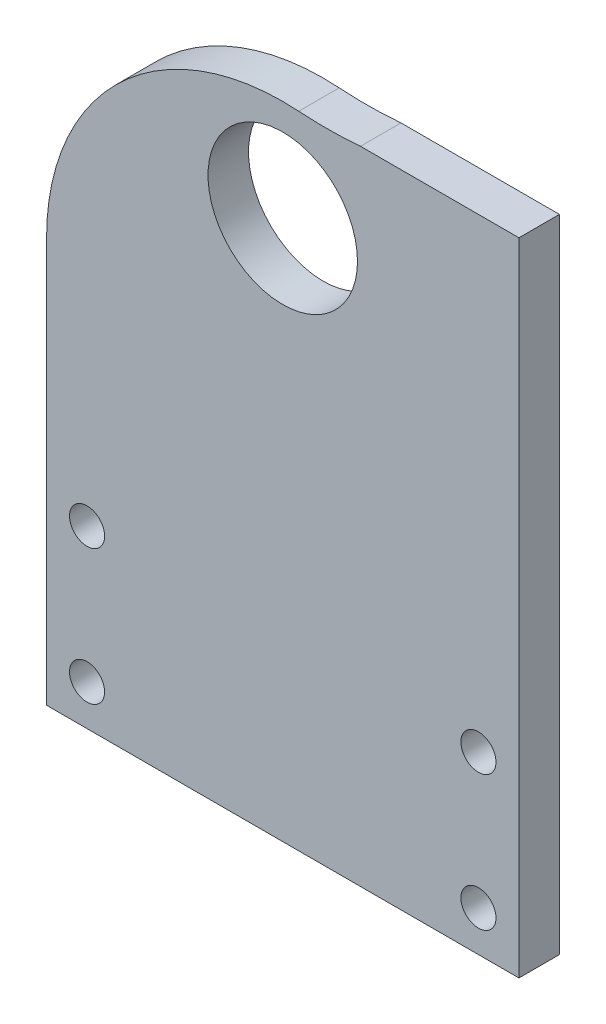
from build123d import *

# Parameters (mm, degrees)
IZIM1_R                     = 11.075
IZIM1_R_2                   = 2.6
Y_KSEKLIK_EKSTR_ZYON1_DEPTH = 6
IZIM2_W                     = 40.176949225
IZIM2_H                     = 32.938980449
Y_KSEKLIK_EKSTR_ZYON2_DEPTH = 6
IZIM3_W                     = 23.482339904
IZIM3_H                     = 35
Y_KSEKLIK_EKSTR_ZYON3_DEPTH = 6
RADYUS1_R                   = 60


with BuildPart() as part:
    # Çizim1 → Yükseklik-Ekstrüzyon1 (new body)
    with BuildSketch(Plane.XY):
        with BuildLine():
            Line((-56.410377678, 29.652139902), (-56.410377678, -30.347860098))
            Line((-56.410377678, -30.347860098), (13.589622322, -30.347860098))
            Line((13.589622322, -30.347860098), (13.589622322, 29.652139902))
            ThreePointArc((13.589622322, 29.652139902), (-21.410377678, 64.652139902), (-56.410377678, 29.652139902))
        make_face()
        with Locations((-21.410377678, 49.652139902)):
            Circle(IZIM1_R, mode=Mode.SUBTRACT)
        with Locations((-50.410377678, -24.347860098)):
            Circle(IZIM1_R_2, mode=Mode.SUBTRACT)
        with Locations((7.589622322, -24.347860098)):
            Circle(IZIM1_R_2, mode=Mode.SUBTRACT)
        with Locations((-50.410377678, -4.347860098)):
            Circle(IZIM1_R_2, mode=Mode.SUBTRACT)
        with Locations((7.589622322, -4.347860098)):
            Circle(IZIM1_R_2, mode=Mode.SUBTRACT)
        with BuildLine():
            Line((-12.410377678, 4.652139902), (-12.410377678, -5.347860098))
            ThreePointArc((-12.410377678, -5.347860098), (-21.410377678, -14.347860098), (-30.410377678, -5.347860098))
            Line((-30.410377678, -5.347860098), (-30.410377678, 4.652139902))
            ThreePointArc((-30.410377678, 4.652139902), (-21.410377678, 13.652139902), (-12.410377678, 4.652139902))
        make_face(mode=Mode.SUBTRACT)
        with BuildLine():
            Line((-33.810377678, 4.652139902), (-33.810377678, -5.347860098))
            ThreePointArc((-33.810377678, -5.347860098), (-35.910377678, -7.447860098), (-38.010377678, -5.347860098))
            Line((-38.010377678, -5.347860098), (-38.010377678, 4.652139902))
            ThreePointArc((-38.010377678, 4.652139902), (-35.910377678, 6.752139902), (-33.810377678, 4.652139902))
        make_face(mode=Mode.SUBTRACT)
        with BuildLine():
            Line((-4.810377678, 4.652139902), (-4.810377678, -5.347860098))
            ThreePointArc((-4.810377678, -5.347860098), (-6.910377678, -7.447860098), (-9.010377678, -5.347860098))
            Line((-9.010377678, -5.347860098), (-9.010377678, 4.652139902))
            ThreePointArc((-9.010377678, 4.652139902), (-6.910377678, 6.752139902), (-4.810377678, 4.652139902))
        make_face(mode=Mode.SUBTRACT)
    extrude(amount=Y_KSEKLIK_EKSTR_ZYON1_DEPTH)

    # Çizim2 → Yükseklik-Ekstrüzyon2 (add)
    with BuildSketch(Plane(origin=(0, 0, 0), x_dir=(-1, 0, 0), z_dir=(0, 0, -1))):
        with Locations((20.088474613, 1.726881697)):
            Rectangle(IZIM2_W, IZIM2_H)
    extrude(amount=-Y_KSEKLIK_EKSTR_ZYON2_DEPTH)

    # Çizim3 → Yükseklik-Ekstrüzyon3 (add)
    with BuildSketch(Plane(origin=(0, 0, 0), x_dir=(-1, 0, 0), z_dir=(0, 0, -1))):
        with Locations((-1.84845237, 47.152139902)):
            Rectangle(IZIM3_W, IZIM3_H)
    extrude(amount=-Y_KSEKLIK_EKSTR_ZYON3_DEPTH)

    # Radyus1
    # the kernel refuses this fillet: 60 mm, written as the material it adds along each edge
    with BuildSketch(Plane(origin=(-9.892717582, 62.702760258, 6), x_dir=(0, 1, 0), z_dir=(0, 0, -1))) as radyus1_piece_1:
        with BuildLine():
            CenterArc((61.73230625, -5.099184882), RADYUS1_R, 175.124756337, 8.749263652)
            Line((1.869405236, -9.152958702), (0.672147215, -9.234034178))
            ThreePointArc((0.672147215, -9.234034178), (0.065725416, -4.753959725), (-1.133164126, -0.394891203))
            Line((-1.133164126, -0.394891203), (0, 1.2))
            ThreePointArc((0, 1.2), (0.974689822, 1.2), (0.753721112, 0.101983698))
            Line((0.753721112, 0.101983698), (1.949379644, 0))
        make_face()
    extrude(amount=6)


solid = part.part
